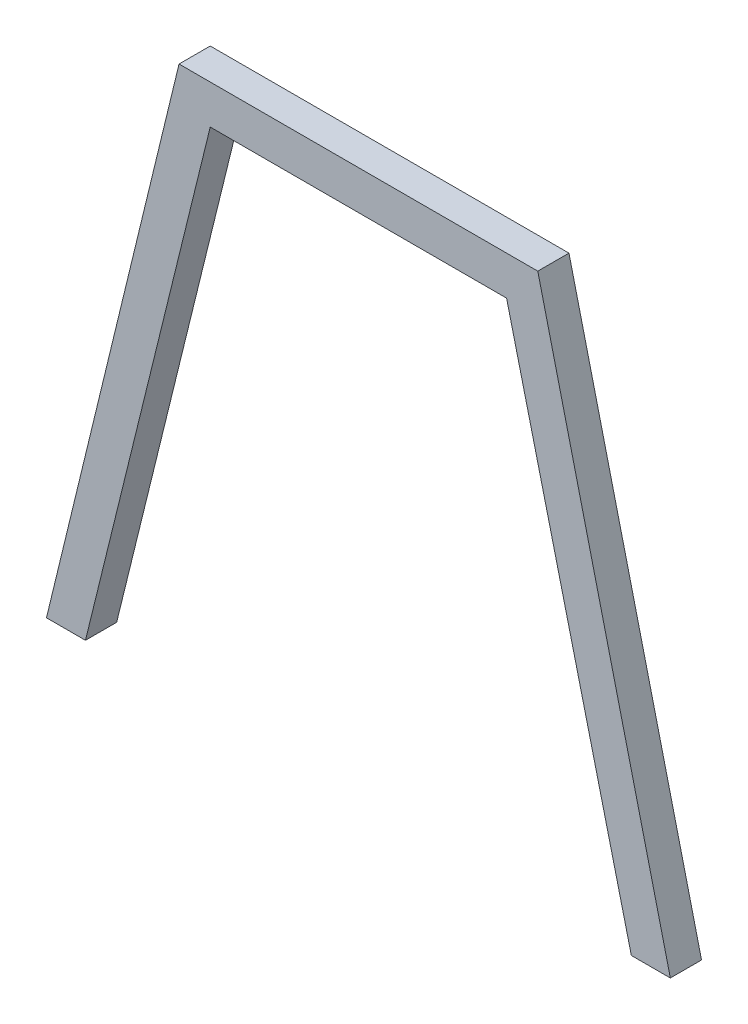
from build123d import *

# Parameters (mm, degrees)
A_FRAME_BLANK_DEPTH   = 10
HOLLOW_WALL_2MM_START = -8
HOLLOW_WALL_2MM_DEPTH = 16


# Read off the part's stored shape, not the designer's step: Hollow_Wall_2mm
with BuildPart() as part:
    # A_Frame_Profile → A_Frame_Blank (new, symmetric)
    with BuildSketch(Plane.XY):
        Polygon((-200, 0), (-115, 350), (115, 350), (200, 0), (175, 0), (95, 325), (-95, 325), (-175, 0), align=None)
    extrude(amount=A_FRAME_BLANK_DEPTH, both=True)

    # Hollow_Wall_2mm outline → Hollow_Wall_2mm (cut)
    with BuildSketch(Plane.XY.offset(HOLLOW_WALL_2MM_START)):
        Polygon((-197.456151033, 2), (-176.567392981, 2), (-96.567392981, 327), (96.567392981, 327), (176.567392981, 2), (197.456151033, 2), (113.427579604, 348), (-113.427579604, 348), align=None)
    extrude(amount=HOLLOW_WALL_2MM_DEPTH, mode=Mode.SUBTRACT)


solid = part.part
